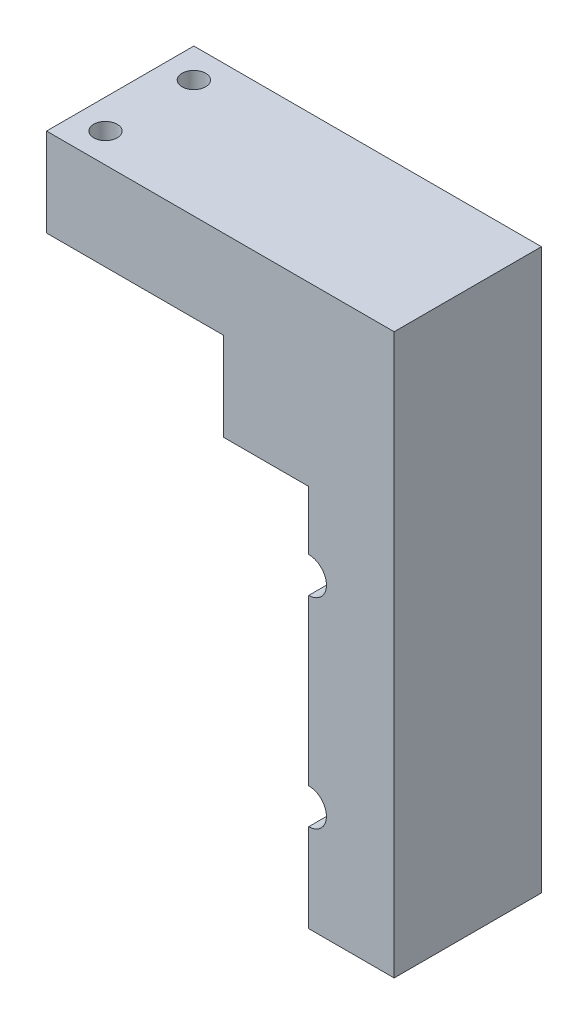
from build123d import *

# Parameters (mm, degrees)
SKETCH_3_W          = 29
SKETCH_3_H          = 95
EXTRUDE_1_DEPTH     = 25
SKETCH_4_R          = 3.005
CUT_EXTRUDE_1_DEPTH = 103.425582742
SKETCH_6_W          = 25
SKETCH_6_H          = 15
EXTRUDE_3_DEPTH     = 30
SKETCH_7_W          = 14.5
SKETCH_7_H          = 65
CUT_EXTRUDE_2_DEPTH = 103.713192921
SKETCH_9_R          = 2
CUT_EXTRUDE_4_DEPTH = 5
SKETCH_10_R         = 2
CUT_EXTRUDE_5_DEPTH = 5
SKETCH_11_R         = 2
CUT_EXTRUDE_6_DEPTH = 5
SKETCH_12_R         = 2
CUT_EXTRUDE_7_DEPTH = 5


with BuildPart() as part:
    # 草图3 → 凸台-拉伸1 (new body)
    with BuildSketch(Plane.XY):
        with Locations((14.5, 47.5)):
            Rectangle(SKETCH_3_W, SKETCH_3_H)
    extrude(amount=EXTRUDE_1_DEPTH)

    # 草图4 → 切除-拉伸1 (cut, through all)
    with BuildSketch(Plane.XY.offset(25)):
        with Locations((14.5, 52)):
            Circle(SKETCH_4_R)
        with Locations((14.5, 18)):
            Circle(SKETCH_4_R)
    extrude(amount=-CUT_EXTRUDE_1_DEPTH, mode=Mode.SUBTRACT)

    # 草图6 → 凸台-拉伸3 (add)
    with BuildSketch(Plane.ZY):
        with Locations((12.5, 87.5)):
            Rectangle(SKETCH_6_W, SKETCH_6_H)
    extrude(amount=EXTRUDE_3_DEPTH)

    # 草图7 → 切除-拉伸2 (cut, through all)
    with BuildSketch(Plane.XY.offset(25)):
        with Locations((7.25, 32.5)):
            Rectangle(SKETCH_7_W, SKETCH_7_H)
    extrude(amount=-CUT_EXTRUDE_2_DEPTH, mode=Mode.SUBTRACT)

    # 草图9 → 切除-拉伸4 (cut)
    with BuildSketch(Plane.ZY.offset(-14.5)):
        with Locations((5, 60.0025)):
            Circle(SKETCH_9_R)
        with Locations((20, 60.0025)):
            Circle(SKETCH_9_R)
    extrude(amount=-CUT_EXTRUDE_4_DEPTH, mode=Mode.SUBTRACT)

    # 草图10 → 切除-拉伸5 (cut)
    with BuildSketch(Plane.ZY.offset(-14.5)):
        with Locations((5, 7.4975)):
            Circle(SKETCH_10_R)
        with Locations((20, 7.4975)):
            Circle(SKETCH_10_R)
    extrude(amount=-CUT_EXTRUDE_5_DEPTH, mode=Mode.SUBTRACT)

    # 草图11 → 切除-拉伸6 (cut)
    with BuildSketch(Plane.ZY.offset(-14.5)):
        with Locations((5, 35)):
            Circle(SKETCH_11_R)
        with Locations((20, 35)):
            Circle(SKETCH_11_R)
    extrude(amount=-CUT_EXTRUDE_6_DEPTH, mode=Mode.SUBTRACT)

    # 草图12 → 切除-拉伸7 (cut)
    with BuildSketch(Plane(origin=(0, 95, 0), x_dir=(1, 0, 0), z_dir=(0, 1, 0))):
        with Locations((-25, -20)):
            Circle(SKETCH_12_R)
        with Locations((-25, -5)):
            Circle(SKETCH_12_R)
    extrude(amount=-CUT_EXTRUDE_7_DEPTH, mode=Mode.SUBTRACT)


solid = part.part
